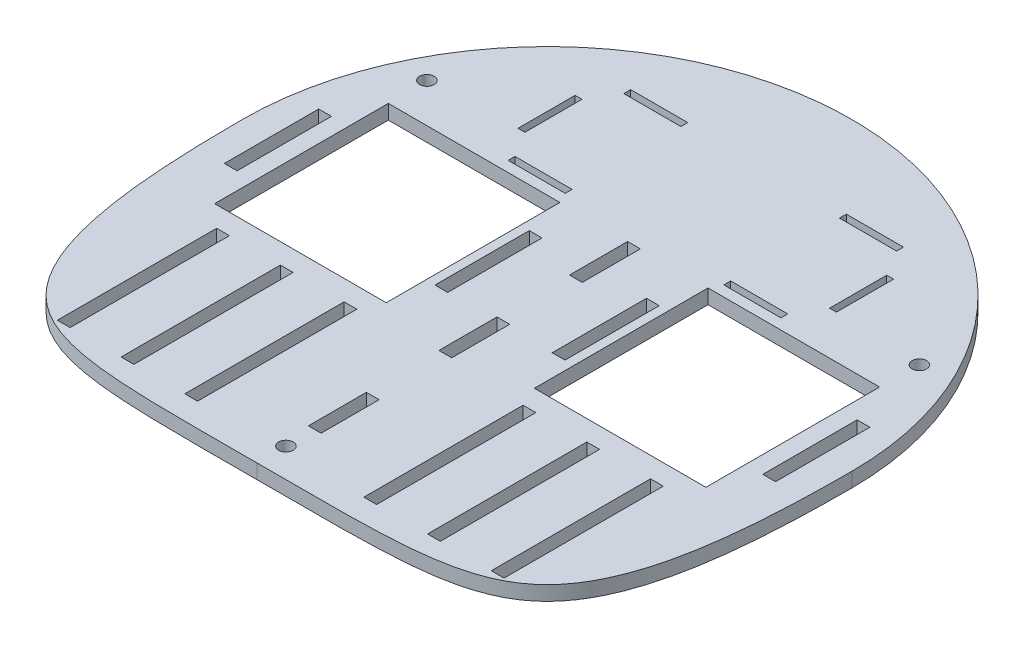
from build123d import *

# Parameters (mm, degrees)
BASE_DEPTH            = 6.35
SKETCH6_W             = 75.0815
SKETCH6_H             = 76
SKETCH6_W_2           = 5.588
SKETCH6_H_2           = 41.275
WHEELSHAFTCUT_DEPTH   = 189.692256213
SKETCH8_W             = 5.588
SKETCH8_H             = 69.7
MOTORCUT_DEPTH        = 189.692256213
SKETCH10_W            = 25
SKETCH10_H            = 3
SKETCH10_W_2          = 3
SKETCH10_H_2          = 25
VELCROCUT_DEPTH       = 189.692256213
SKETCH11_R            = 3.175
SCREWCUT_DEPTH        = 189.692256213
SKETCH13_W            = 5.588
SKETCH13_H            = 25.4
SUPPORTSTRUTCUT_DEPTH = 189.692256213


with BuildPart() as part:
    # Sketch1 → Base (new body)
    with BuildSketch(Plane(origin=(0, 0, 0), x_dir=(1, 0, 0), z_dir=(0, 1, 0))):
        with BuildLine():
            ThreePointArc((133.35, 0), (0, 133.35), (-133.35, 0))
            add(Edge.make_bspline(
                [(-133.35, 0), (-133.35, -51.197979728), (-123.803376308, -129.805052089), (-58.427993604, -127), (0, -127)],
                knots=[0, 0, 0, 0, 0.502616309, 1, 1, 1, 1], degree=3))
            add(Edge.make_bspline(
                [(133.35, 0), (133.35, -51.197979728), (123.803376308, -129.805052089), (58.427993604, -127), (0, -127)],
                knots=[0, 0, 0, 0, 0.502616309, 1, 1, 1, 1], degree=3))
        make_face()
    extrude(amount=BASE_DEPTH)

    # Sketch6 → WheelShaftCut (cut, through all)
    with BuildSketch(Plane(origin=(0, 6.35, 0), x_dir=(1, 0, 0), z_dir=(0, 1, 0))):
        with Locations((-69.957348141, 0)):
            Rectangle(SKETCH6_W, SKETCH6_H)
        with Locations((-117.816848141, 0)):
            Rectangle(SKETCH6_W_2, SKETCH6_H_2)
        with Locations((-25.653848141, 0)):
            Rectangle(SKETCH6_W_2, SKETCH6_H_2)
        with Locations((25.653848141, 0)):
            Rectangle(SKETCH6_W_2, SKETCH6_H_2)
        with Locations((117.816848141, 0)):
            Rectangle(SKETCH6_W_2, SKETCH6_H_2)
        with Locations((69.957348141, 0)):
            Rectangle(SKETCH6_W, SKETCH6_H)
    extrude(amount=-WHEELSHAFTCUT_DEPTH, mode=Mode.SUBTRACT)

    # Sketch8 → MotorCut (cut, through all)
    with BuildSketch(Plane(origin=(0, 6.35, 0), x_dir=(1, 0, 0), z_dir=(0, 1, 0))):
        with Locations((-39.174460242, -81.74)):
            Rectangle(SKETCH8_W, SKETCH8_H)
        with Locations((-67.057904192, -81.74)):
            Rectangle(SKETCH8_W, SKETCH8_H)
        with Locations((-94.941348141, -81.74)):
            Rectangle(SKETCH8_W, SKETCH8_H)
        with Locations((94.941348141, -81.74)):
            Rectangle(SKETCH8_W, SKETCH8_H)
        with Locations((67.057904192, -81.74)):
            Rectangle(SKETCH8_W, SKETCH8_H)
        with Locations((39.174460242, -81.74)):
            Rectangle(SKETCH8_W, SKETCH8_H)
    extrude(amount=-MOTORCUT_DEPTH, mode=Mode.SUBTRACT)

    # Sketch10 → VelcroCut (cut, through all)
    with BuildSketch(Plane(origin=(0, 6.35, 0), x_dir=(1, 0, 0), z_dir=(0, 1, 0))):
        with Locations((-47.19, 44.12)):
            Rectangle(SKETCH10_W, SKETCH10_H)
        with Locations((-47.19, 94.745)):
            Rectangle(SKETCH10_W, SKETCH10_H)
        with Locations((-68.175, 69.4325)):
            Rectangle(SKETCH10_W_2, SKETCH10_H_2)
        with Locations((68.175, 69.4325)):
            Rectangle(SKETCH10_W_2, SKETCH10_H_2)
        with Locations((47.19, 94.745)):
            Rectangle(SKETCH10_W, SKETCH10_H)
        with Locations((47.19, 44.12)):
            Rectangle(SKETCH10_W, SKETCH10_H)
    extrude(amount=-VELCROCUT_DEPTH, mode=Mode.SUBTRACT)

    # Sketch11 → ScrewCut (cut, through all)
    with BuildSketch(Plane(origin=(0, 6.35, 0), x_dir=(1, 0, 0), z_dir=(0, 1, 0))):
        with Locations((0, -114.3)):
            Circle(SKETCH11_R)
        with Locations((-107.775, 55.145)):
            Circle(SKETCH11_R)
        with Locations((107.775, 55.145)):
            Circle(SKETCH11_R)
    extrude(amount=-SCREWCUT_DEPTH, mode=Mode.SUBTRACT)

    # Sketch13 → SupportStrutCut (cut, through all)
    with BuildSketch(Plane(origin=(0, 6.35, 0), x_dir=(1, 0, 0), z_dir=(0, 1, 0))):
        with Locations((0, 25.3)):
            Rectangle(SKETCH13_W, SKETCH13_H)
        with Locations((0, -31.85)):
            Rectangle(SKETCH13_W, SKETCH13_H)
        with Locations((0, -89)):
            Rectangle(SKETCH13_W, SKETCH13_H)
    extrude(amount=-SUPPORTSTRUTCUT_DEPTH, mode=Mode.SUBTRACT)


solid = part.part
